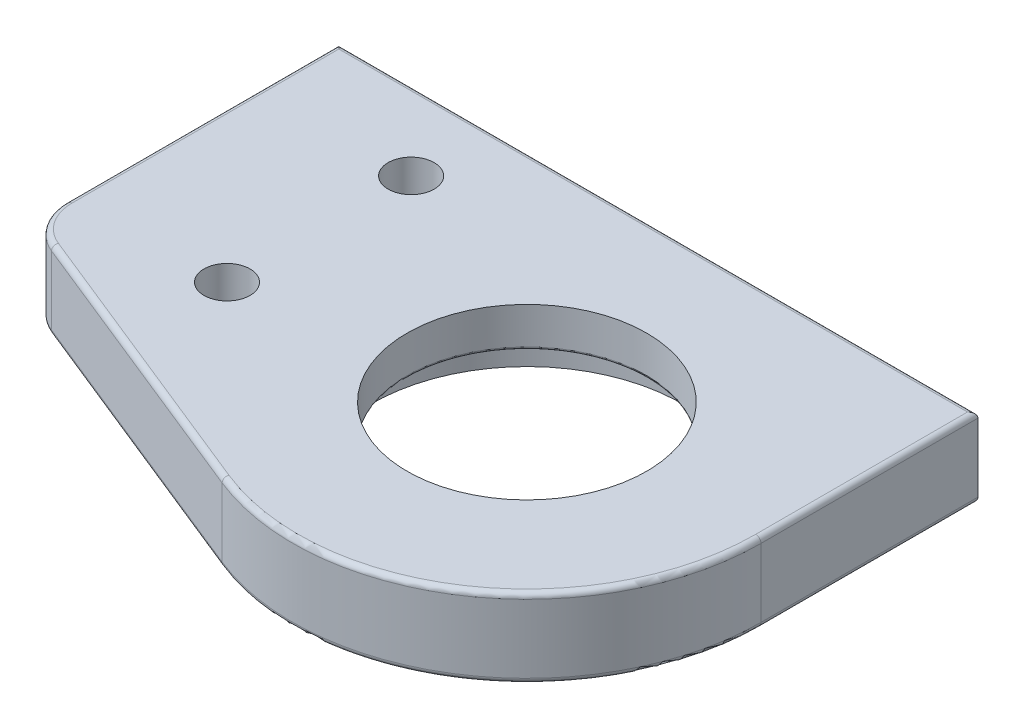
from build123d import *

# Parameters (mm, degrees)
BOSS_EXTRUDE1_DEPTH = 30
SKETCH4_R           = 59
CUT_EXTRUDE1_DEPTH  = 15
SKETCH7_R           = 45.53
CUT_EXTRUDE2_DEPTH  = 179.499299719
FILLET1_R           = 2
SKETCH10_R          = 8.75
CUT_EXTRUDE4_DEPTH  = 20
SKETCH10_3_R        = 7
CUT_EXTRUDE5_DEPTH  = 8
THREAD10_PITCH      = 2.5
THREAD11_PITCH      = 2.5
SKETCH10_5_R        = 7
CUT_EXTRUDE7_DEPTH  = 8
THREAD14_PITCH      = 2
THREAD15_PITCH      = 2
SKETCH12_R          = 8.75
CUT_EXTRUDE8_DEPTH  = 181.380154204
LPATTERN1_COUNT     = 2
LPATTERN1_PITCH     = 70
FILLET2_R           = 1
SKETCH16_R          = 12
CUT_EXTRUDE10_DEPTH = 5
LOREN_M5_X16_START  = 15
SKETCH17_R          = 2.1
LOREN_M5_X16_DEPTH  = 10


with BuildPart() as part:
    # Sketch2 → Boss-Extrude1 (new body)
    with BuildSketch(Plane(origin=(0, 0, 0), x_dir=(1, 0, 0), z_dir=(0, 1, 0))):
        with BuildLine():
            Line((-154, 82.5), (-154, -20.969213999))
            ThreePointArc((-154, -20.969213999), (-150.751070551, -31.594832875), (-142.115391946, -38.586569006))
            Line((-142.115391946, -38.586569006), (-33.329993854, -82.523399771))
            ThreePointArc((-33.329993854, -82.523399771), (49.77263579, -73.781330474), (89, 0))
            Line((89, 0), (89, 82.5))
            Line((89, 82.5), (-154, 82.5))
        make_face()
    extrude(amount=BOSS_EXTRUDE1_DEPTH)

    # Sketch4 → Cut-Extrude1 (cut)
    with BuildSketch(Plane(origin=(0, 0, 0), x_dir=(1, 0, 0), z_dir=(0, 1, 0))):
        with Locations(Location((0, 0, 0), (0, 0, 270))):
            Circle(SKETCH4_R)
    extrude(amount=CUT_EXTRUDE1_DEPTH, mode=Mode.SUBTRACT)

    # Sketch7 → Cut-Extrude2 (cut, through all)
    with BuildSketch(Plane.XZ.offset(-15)):
        with Locations(Location((0, 0, 0), (0, 0, 270))):
            Circle(SKETCH7_R)
    extrude(amount=-CUT_EXTRUDE2_DEPTH, mode=Mode.SUBTRACT)

    # Fillet1
    fillet1_edges = [part.edges().sort_by_distance(p)[0] for p in [
        (-150.751070551, 30, 31.594832875),
        (-87.7226929, 30, 60.554984388),
        (49.77263579, 30, 73.781330474),
        (89, 30, -41.25),
        (-32.5, 30, -82.5),
        (89, 0, -41.25),
        (49.77263579, 0, 73.781330474),
        (-87.7226929, 0, 60.554984388),
        (-150.751070551, 0, 31.594832875),
        (-154, 0, -30.765393001),
        (-32.5, 0, -82.5),
        (-154, 30, -30.765393001),
    ]]
    fillet(fillet1_edges, radius=FILLET1_R)

    # Sketch10 → Cut-Extrude4 (cut)
    with BuildSketch(Plane(origin=(0, 0, -82.5), x_dir=(-1, 0, 0), z_dir=(0, 0, -1))):
        with Locations((-65, 15)):
            Circle(SKETCH10_R)
        with Locations((124, 15)):
            Circle(SKETCH10_R)
    extrude(amount=-CUT_EXTRUDE4_DEPTH, mode=Mode.SUBTRACT)

    # Sketch10<3> → Cut-Extrude5 (cut)
    with BuildSketch(Plane(origin=(0, 0, -82.5), x_dir=(-1, 0, 0), z_dir=(0, 0, -1))):
        with Locations((17, 15)):
            Circle(SKETCH10_3_R)
    extrude(amount=-CUT_EXTRUDE5_DEPTH, mode=Mode.SUBTRACT)

    # Thread10: arcs per turn and ends read off the stored shape
    # Thread10: the profile of Thread Profile10 profile screwed along a right-hand helix through 8 turns, 10 arcs to a turn; built about Z, then put on its axis
    thread10_z = Axis((0, 0, 0), (0, 0, 1))
    thread10_corners = [(8.7497, 0, -0.000173205), (10.103164687, 0, 0.781249997), (10.103164687, 0, 1.093749997), (8.7497, 0, 1.875173198)]
    with BuildLine(mode=Mode.PRIVATE) as thread10_profile:
        Line(thread10_corners[0], thread10_corners[1])
        Line(thread10_corners[1], thread10_corners[2])
        Line(thread10_corners[2], thread10_corners[3])
        Line(thread10_corners[3], thread10_corners[0])
    thread10_cap = Face(thread10_profile.wire())
    thread10_turn_angles = [0, 18, 36, 54, 72, 90, 108, 126, 144, 162, 180, 198, 216, 234, 252, 270, 288, 306, 324, 342, 360]
    thread10_turn_weights = [1, 0.9510565162951535, 1, 0.9510565162951535, 1, 0.9510565162951535, 1, 0.9510565162951535, 1, 0.9510565162951535, 1, 0.9510565162951535, 1, 0.9510565162951535, 1, 0.9510565162951535, 1, 0.9510565162951535, 1, 0.9510565162951535, 1]
    thread10_turn_rails = [Edge.make_bspline([Vector(p[0], p[1], 0).rotate(thread10_z, thread10_turn_angles[k]) / thread10_turn_weights[k] + Vector(0, 0, p[2] + THREAD10_PITCH * thread10_turn_angles[k] / 360) for k in range(21)], [0, 0, 0, 1, 1, 2, 2, 3, 3, 4, 4, 5, 5, 6, 6, 7, 7, 8, 8, 9, 9, 10, 10, 10], 2, thread10_turn_weights) for p in thread10_corners]
    thread10_turn_sides = [Face.make_surface_from_curves(thread10_turn_rails[p[0]], thread10_turn_rails[p[1]]) for p in [(0, 1), (1, 2), (2, 3), (3, 0)]]
    thread10 = Plane(origin=(65, 15, -62.5), x_dir=(-1, 0, 0), z_dir=(0, 0, -1)) * Solid(Shell([*[p.moved(Location((0, 0, THREAD10_PITCH * i))) for i in range(8) for p in thread10_turn_sides], thread10_cap, thread10_cap.rotate(thread10_z, 2880).moved(Location((0, 0, THREAD10_PITCH * 2880 / 360)))]))
    add(thread10, mode=Mode.SUBTRACT)

    # Thread11: arcs per turn and ends read off the stored shape
    # Thread11: the profile of Thread Profile11 profile screwed along a right-hand helix through 8 turns, 10 arcs to a turn; built about Z, then put on its axis
    thread11_z = Axis((0, 0, 0), (0, 0, 1))
    thread11_corners = [(8.7497, 0, -0.000173205), (10.103164687, 0, 0.781249997), (10.103164687, 0, 1.093749997), (8.7497, 0, 1.875173198)]
    with BuildLine(mode=Mode.PRIVATE) as thread11_profile:
        Line(thread11_corners[0], thread11_corners[1])
        Line(thread11_corners[1], thread11_corners[2])
        Line(thread11_corners[2], thread11_corners[3])
        Line(thread11_corners[3], thread11_corners[0])
    thread11_cap = Face(thread11_profile.wire())
    thread11_turn_angles = [0, 18, 36, 54, 72, 90, 108, 126, 144, 162, 180, 198, 216, 234, 252, 270, 288, 306, 324, 342, 360]
    thread11_turn_weights = [1, 0.9510565162951535, 1, 0.9510565162951535, 1, 0.9510565162951535, 1, 0.9510565162951535, 1, 0.9510565162951535, 1, 0.9510565162951535, 1, 0.9510565162951535, 1, 0.9510565162951535, 1, 0.9510565162951535, 1, 0.9510565162951535, 1]
    thread11_turn_rails = [Edge.make_bspline([Vector(p[0], p[1], 0).rotate(thread11_z, thread11_turn_angles[k]) / thread11_turn_weights[k] + Vector(0, 0, p[2] + THREAD11_PITCH * thread11_turn_angles[k] / 360) for k in range(21)], [0, 0, 0, 1, 1, 2, 2, 3, 3, 4, 4, 5, 5, 6, 6, 7, 7, 8, 8, 9, 9, 10, 10, 10], 2, thread11_turn_weights) for p in thread11_corners]
    thread11_turn_sides = [Face.make_surface_from_curves(thread11_turn_rails[p[0]], thread11_turn_rails[p[1]]) for p in [(0, 1), (1, 2), (2, 3), (3, 0)]]
    thread11 = Plane(origin=(-124, 15, -62.5), x_dir=(-1, 0, 0), z_dir=(0, 0, -1)) * Solid(Shell([*[p.moved(Location((0, 0, THREAD11_PITCH * i))) for i in range(8) for p in thread11_turn_sides], thread11_cap, thread11_cap.rotate(thread11_z, 2880).moved(Location((0, 0, THREAD11_PITCH * 2880 / 360)))]))
    add(thread11, mode=Mode.SUBTRACT)

    # Sketch10<5> → Cut-Extrude7 (cut)
    with BuildSketch(Plane(origin=(0, 0, -82.5), x_dir=(-1, 0, 0), z_dir=(0, 0, -1))):
        with Locations((42, 15)):
            Circle(SKETCH10_5_R)
    extrude(amount=-CUT_EXTRUDE7_DEPTH, mode=Mode.SUBTRACT)

    # Thread14: arcs per turn and ends read off the stored shape
    # Thread14: the profile of Thread Profile17 profile screwed along a right-hand helix through 7.5 turns, 10 arcs to a turn; built about Z, then put on its axis
    thread14_z = Axis((0, 0, 0), (0, 0, 1))
    thread14_corners = [(6.9997, 0, -0.000173205), (8.08253175, 0, 0.624999997), (8.08253175, 0, 0.874999997), (6.9997, 0, 1.5001732)]
    with BuildLine(mode=Mode.PRIVATE) as thread14_profile:
        Line(thread14_corners[0], thread14_corners[1])
        Line(thread14_corners[1], thread14_corners[2])
        Line(thread14_corners[2], thread14_corners[3])
        Line(thread14_corners[3], thread14_corners[0])
    thread14_cap = Face(thread14_profile.wire())
    thread14_turn_angles = [0, 18, 36, 54, 72, 90, 108, 126, 144, 162, 180, 198, 216, 234, 252, 270, 288, 306, 324, 342, 360]
    thread14_turn_weights = [1, 0.9510565162951535, 1, 0.9510565162951535, 1, 0.9510565162951535, 1, 0.9510565162951535, 1, 0.9510565162951535, 1, 0.9510565162951535, 1, 0.9510565162951535, 1, 0.9510565162951535, 1, 0.9510565162951535, 1, 0.9510565162951535, 1]
    thread14_turn_rails = [Edge.make_bspline([Vector(p[0], p[1], 0).rotate(thread14_z, thread14_turn_angles[k]) / thread14_turn_weights[k] + Vector(0, 0, p[2] + THREAD14_PITCH * thread14_turn_angles[k] / 360) for k in range(21)], [0, 0, 0, 1, 1, 2, 2, 3, 3, 4, 4, 5, 5, 6, 6, 7, 7, 8, 8, 9, 9, 10, 10, 10], 2, thread14_turn_weights) for p in thread14_corners]
    thread14_turn_sides = [Face.make_surface_from_curves(thread14_turn_rails[p[0]], thread14_turn_rails[p[1]]) for p in [(0, 1), (1, 2), (2, 3), (3, 0)]]
    thread14_last_angles = [2520, 2538, 2556, 2574, 2592, 2610, 2628, 2646, 2664, 2682, 2700]
    thread14_last_weights = [1, 0.9510565162951535, 1, 0.9510565162951535, 1, 0.9510565162951535, 1, 0.9510565162951535, 1, 0.9510565162951535, 1]
    thread14_last_rails = [Edge.make_bspline([Vector(p[0], p[1], 0).rotate(thread14_z, thread14_last_angles[k]) / thread14_last_weights[k] + Vector(0, 0, p[2] + THREAD14_PITCH * thread14_last_angles[k] / 360) for k in range(11)], [0, 0, 0, 1, 1, 2, 2, 3, 3, 4, 4, 5, 5, 5], 2, thread14_last_weights) for p in thread14_corners]
    thread14_last_sides = [Face.make_surface_from_curves(thread14_last_rails[p[0]], thread14_last_rails[p[1]]) for p in [(0, 1), (1, 2), (2, 3), (3, 0)]]
    thread14 = Plane(origin=(-42, 15, -74.5), x_dir=(-1, 0, 0), z_dir=(0, 0, -1)) * Solid(Shell([*[p.moved(Location((0, 0, THREAD14_PITCH * i))) for i in range(7) for p in thread14_turn_sides], *thread14_last_sides, thread14_cap, thread14_cap.rotate(thread14_z, 2700).moved(Location((0, 0, THREAD14_PITCH * 2700 / 360)))]))
    add(thread14, mode=Mode.SUBTRACT)

    # Thread15: arcs per turn and ends read off the stored shape
    # Thread15: the profile of Thread Profile18 profile screwed along a right-hand helix through 4 turns, 10 arcs to a turn; built about Z, then put on its axis
    thread15_z = Axis((0, 0, 0), (0, 0, 1))
    thread15_corners = [(6.9997, 0, -0.000173205), (8.08253175, 0, 0.624999997), (8.08253175, 0, 0.874999997), (6.9997, 0, 1.5001732)]
    with BuildLine(mode=Mode.PRIVATE) as thread15_profile:
        Line(thread15_corners[0], thread15_corners[1])
        Line(thread15_corners[1], thread15_corners[2])
        Line(thread15_corners[2], thread15_corners[3])
        Line(thread15_corners[3], thread15_corners[0])
    thread15_cap = Face(thread15_profile.wire())
    thread15_turn_angles = [0, 18, 36, 54, 72, 90, 108, 126, 144, 162, 180, 198, 216, 234, 252, 270, 288, 306, 324, 342, 360]
    thread15_turn_weights = [1, 0.9510565162951535, 1, 0.9510565162951535, 1, 0.9510565162951535, 1, 0.9510565162951535, 1, 0.9510565162951535, 1, 0.9510565162951535, 1, 0.9510565162951535, 1, 0.9510565162951535, 1, 0.9510565162951535, 1, 0.9510565162951535, 1]
    thread15_turn_rails = [Edge.make_bspline([Vector(p[0], p[1], 0).rotate(thread15_z, thread15_turn_angles[k]) / thread15_turn_weights[k] + Vector(0, 0, p[2] + THREAD15_PITCH * thread15_turn_angles[k] / 360) for k in range(21)], [0, 0, 0, 1, 1, 2, 2, 3, 3, 4, 4, 5, 5, 6, 6, 7, 7, 8, 8, 9, 9, 10, 10, 10], 2, thread15_turn_weights) for p in thread15_corners]
    thread15_turn_sides = [Face.make_surface_from_curves(thread15_turn_rails[p[0]], thread15_turn_rails[p[1]]) for p in [(0, 1), (1, 2), (2, 3), (3, 0)]]
    thread15 = Plane(origin=(-17, 15, -74.5), x_dir=(-1, 0, 0), z_dir=(0, 0, -1)) * Solid(Shell([*[p.moved(Location((0, 0, THREAD15_PITCH * i))) for i in range(4) for p in thread15_turn_sides], thread15_cap, thread15_cap.rotate(thread15_z, 1440).moved(Location((0, 0, THREAD15_PITCH * 1440 / 360)))]))
    add(thread15, mode=Mode.SUBTRACT)

    # Sketch12 → Cut-Extrude8 (cut, through all)
    with BuildSketch(Plane(origin=(0, 30, 0), x_dir=(1, 0, 0), z_dir=(0, 1, 0))):
        with Locations(Location((-96.5, 52.5, 0), (0, 0, 270))):
            Circle(SKETCH12_R)
    cut_extrude8 = extrude(amount=-CUT_EXTRUDE8_DEPTH, mode=Mode.SUBTRACT)

    # LPattern1: Cut-Extrude8 ×2
    with Locations(*[(0, 0, i * LPATTERN1_PITCH) for i in range(1, LPATTERN1_COUNT)]):
        add(cut_extrude8, mode=Mode.SUBTRACT)

    # Fillet2
    fillet2_edges = [part.edges().sort_by_distance(p)[0] for p in [
        (0, 15, 45.53),
    ]]
    fillet(fillet2_edges, radius=FILLET2_R)

    # Sketch16 → Cut-Extrude10 (cut)
    with BuildSketch(Plane.XZ):
        with Locations(Location((-96.5, 17.5, 0), (0, 0, 270))):
            Circle(SKETCH16_R)
        with Locations(Location((-96.5, -52.5, 0), (0, 0, 270))):
            Circle(SKETCH16_R)
    extrude(amount=-CUT_EXTRUDE10_DEPTH, mode=Mode.SUBTRACT)

    # Sketch17 → LoRen-M5-x16 (cut)
    with BuildSketch(Plane(origin=(0, 0, 0), x_dir=(1, 0, 0), z_dir=(0, 1, 0)).offset(LOREN_M5_X16_START)):
        with Locations(Location((31.361, 44.573, 0), (0, 0, 270))):
            Circle(SKETCH17_R)
        with Locations(Location((11.916, 53.181, 0), (0, 0, 270))):
            Circle(SKETCH17_R)
        with Locations(Location((-9.342, 53.693, 0), (0, 0, 270))):
            Circle(SKETCH17_R)
        with Locations(Location((-29.179, 46.031, 0), (0, 0, 270))):
            Circle(SKETCH17_R)
        with Locations(Location((-44.573, 31.361, 0), (0, 0, 270))):
            Circle(SKETCH17_R)
        with Locations(Location((-53.181, 11.916, 0), (0, 0, 270))):
            Circle(SKETCH17_R)
        with Locations(Location((-53.693, -9.342, 0), (0, 0, 270))):
            Circle(SKETCH17_R)
        with Locations(Location((-46.031, -29.179, 0), (0, 0, 270))):
            Circle(SKETCH17_R)
        with Locations(Location((-31.361, -44.573, 0), (0, 0, 270))):
            Circle(SKETCH17_R)
        with Locations(Location((-11.916, -53.181, 0), (0, 0, 270))):
            Circle(SKETCH17_R)
        with Locations(Location((9.342, -53.693, 0), (0, 0, 270))):
            Circle(SKETCH17_R)
        with Locations(Location((29.179, -46.031, 0), (0, 0, 270))):
            Circle(SKETCH17_R)
        with Locations(Location((44.573, -31.361, 0), (0, 0, 270))):
            Circle(SKETCH17_R)
        with Locations(Location((53.181, -11.916, 0), (0, 0, 270))):
            Circle(SKETCH17_R)
        with Locations(Location((53.693, 9.342, 0), (0, 0, 270))):
            Circle(SKETCH17_R)
        with Locations(Location((46.031, 29.179, 0), (0, 0, 270))):
            Circle(SKETCH17_R)
    extrude(amount=LOREN_M5_X16_DEPTH, mode=Mode.SUBTRACT)


solid = part.part
